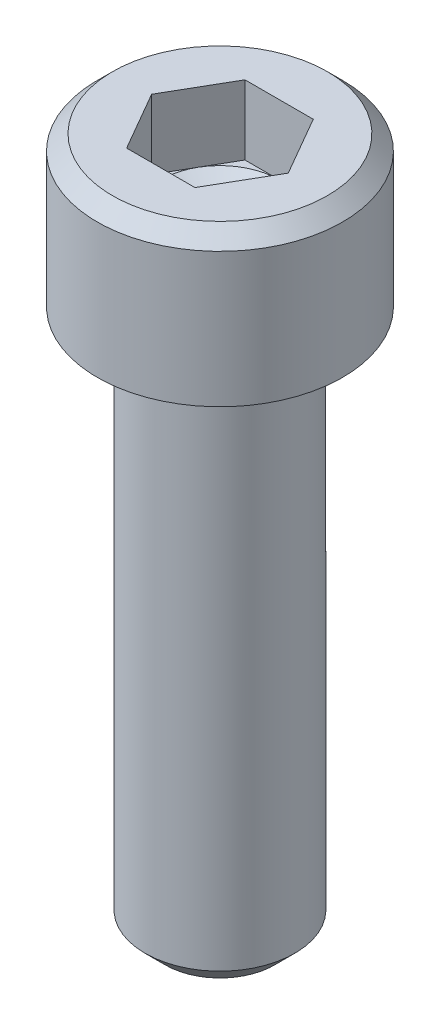
from build123d import *

# Parameters (mm, degrees)
SKETCH1_W           = 2.8702
SKETCH1_H           = 3.5052
SKETCH2_R           = 1.7526
BOSS_EXTRUDE1_DEPTH = 12.7
CUT_EXTRUDE1_DEPTH  = 1.6256
CHAMFER1_SIZE       = 0.47244
CHAMFER2_SIZE       = 0.3556
FILLET1_R           = 0.254


with BuildPart() as part:
    # Sketch1 → Revolve1 (revolve)
    with BuildSketch(Plane.XY):
        with Locations((1.4351, 1.7526)):
            Rectangle(SKETCH1_W, SKETCH1_H)
    revolve(axis=Axis((0, 3.5052, 0), (0, -1, 0)))

    # Sketch2 → Boss-Extrude1 (add)
    with BuildSketch(Plane.XZ):
        Circle(SKETCH2_R)
    extrude(amount=BOSS_EXTRUDE1_DEPTH)

    # Sketch3 → Cut-Extrude1 (cut)
    with BuildSketch(Plane(origin=(0, 3.5052, 0), x_dir=(-1, 0, 0), z_dir=(0, 1, 0))):
        Polygon((-0.799225978, 1.3843), (-1.598451955, 0), (-0.799225978, -1.3843), (0.799225978, -1.3843), (1.598451955, 0), (0.799225978, 1.3843), align=None)
    extrude(amount=-CUT_EXTRUDE1_DEPTH, mode=Mode.SUBTRACT)

    # Sketch4 → Cut-Revolve1 (revolve, cut)
    with BuildSketch(Plane.XY):
        Polygon((1.3843, 1.8796), (0, 1.8796), (0, 1.080374022), align=None)
    revolve(axis=Axis((0, 1.879625, 0), (0, -1, 0)), mode=Mode.SUBTRACT)

    # Chamfer1
    chamfer1_edges = [part.edges().sort_by_distance(p)[0] for p in [
        (-1.7526, -12.7, 0),
    ]]
    chamfer(chamfer1_edges, length=CHAMFER1_SIZE)

    # Chamfer2
    chamfer2_edges = [part.edges().sort_by_distance(p)[0] for p in [
        (-2.8702, 3.5052, 0),
    ]]
    chamfer(chamfer2_edges, length=CHAMFER2_SIZE)

    # Fillet1
    fillet1_edges = [part.edges().sort_by_distance(p)[0] for p in [
        (-1.7526, 0, 0),
    ]]
    fillet(fillet1_edges, radius=FILLET1_R)


solid = part.part
